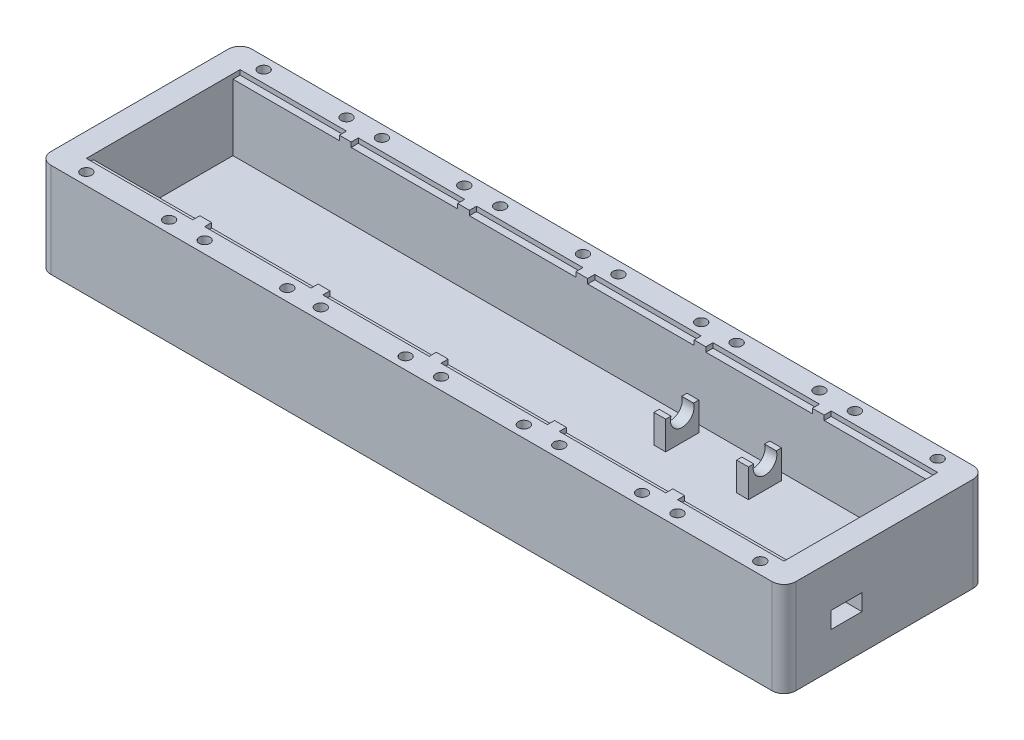
from build123d import *

# Parameters (mm, degrees)
SKIZZE2_W                       = 315
SKIZZE2_H                       = 40
AUFSATZ_LINEAR_AUSTRAGEN1_DEPTH = 85
SKIZZE4_W                       = 295
SKIZZE4_H                       = 59
SCHNITT_LINEAR_AUSTRAGEN1_DEPTH = 30
SKIZZE11_W                      = 45
SKIZZE11_H                      = 3
SKIZZE11_H_2                    = 3.008661904
SCHNITT_LINEAR_AUSTRAGEN4_DEPTH = 2
SKIZZE17_R                      = 2.3
SCHNITT_LINEAR_AUSTRAGEN6_DEPTH = 4
VERRUNDUNG2_R                   = 5
VERRUNDUNG3_R                   = 5
VERRUNDUNG4_R                   = 5
VERRUNDUNG6_R                   = 5
SKIZZE18_W                      = 13
SKIZZE18_H                      = 7
SCHNITT_LINEAR_AUSTRAGEN7_DEPTH = 10
SKIZZE20_W                      = 5
SKIZZE20_H                      = 14
AUFSATZ_LINEAR_AUSTRAGEN2_DEPTH = 12
SKIZZE21_R                      = 5
SCHNITT_LINEAR_AUSTRAGEN8_DEPTH = 71


with BuildPart() as part:
    # Skizze2 → Aufsatz-Linear austragen1 (new body)
    with BuildSketch(Plane.XY):
        with Locations((157.5, 20)):
            Rectangle(SKIZZE2_W, SKIZZE2_H)
    extrude(amount=AUFSATZ_LINEAR_AUSTRAGEN1_DEPTH)

    # Skizze4 → Schnitt-Linear austragen1 (cut)
    with BuildSketch(Plane(origin=(0, 40, 0), x_dir=(1, 0, 0), z_dir=(0, 1, 0))):
        with Locations((157.5, -42.5)):
            Rectangle(SKIZZE4_W, SKIZZE4_H)
    extrude(amount=-SCHNITT_LINEAR_AUSTRAGEN1_DEPTH, mode=Mode.SUBTRACT)

    # Skizze11 → Schnitt-Linear austragen4 (cut)
    with BuildSketch(Plane(origin=(0, 40, 0), x_dir=(1, 0, 0), z_dir=(0, 1, 0))):
        with Locations((32.5, -11.5)):
            Rectangle(SKIZZE11_W, SKIZZE11_H)
        with Locations((32.5, -73.5)):
            Rectangle(SKIZZE11_W, SKIZZE11_H)
        with Locations((82.5, -73.5)):
            Rectangle(SKIZZE11_W, SKIZZE11_H)
        with Locations((132.5, -73.504330952)):
            Rectangle(SKIZZE11_W, SKIZZE11_H_2)
        with Locations((182.5, -73.504330952)):
            Rectangle(SKIZZE11_W, SKIZZE11_H_2)
        with Locations((232.5, -73.5)):
            Rectangle(SKIZZE11_W, SKIZZE11_H)
        with Locations((282.5, -73.5)):
            Rectangle(SKIZZE11_W, SKIZZE11_H)
        with Locations((282.5, -11.5)):
            Rectangle(SKIZZE11_W, SKIZZE11_H)
        with Locations((232.5, -11.5)):
            Rectangle(SKIZZE11_W, SKIZZE11_H)
        with Locations((182.5, -11.5)):
            Rectangle(SKIZZE11_W, SKIZZE11_H)
        with Locations((132.5, -11.5)):
            Rectangle(SKIZZE11_W, SKIZZE11_H)
        with Locations((82.5, -11.5)):
            Rectangle(SKIZZE11_W, SKIZZE11_H)
    extrude(amount=-SCHNITT_LINEAR_AUSTRAGEN4_DEPTH, mode=Mode.SUBTRACT)

    # Skizze17 → Schnitt-Linear austragen6 (cut)
    with BuildSketch(Plane(origin=(0, 40, 0), x_dir=(1, 0, 0), z_dir=(0, 1, 0))):
        with Locations((50, -80)):
            Circle(SKIZZE17_R)
        with Locations((15, -80)):
            Circle(SKIZZE17_R)
        with Locations((15, -5)):
            Circle(SKIZZE17_R)
        with Locations((50, -5)):
            Circle(SKIZZE17_R)
        with Locations((65, -5)):
            Circle(SKIZZE17_R)
        with Locations((99.834927097, -5)):
            Circle(SKIZZE17_R)
        with Locations((65, -80)):
            Circle(SKIZZE17_R)
        with Locations((100, -80)):
            Circle(SKIZZE17_R)
        with Locations((114.145512134, -80)):
            Circle(SKIZZE17_R)
        with Locations((150, -80)):
            Circle(SKIZZE17_R)
        with Locations((165, -80)):
            Circle(SKIZZE17_R)
        with Locations((200, -80)):
            Circle(SKIZZE17_R)
        with Locations((215, -80)):
            Circle(SKIZZE17_R)
        with Locations((250, -80)):
            Circle(SKIZZE17_R)
        with Locations((265, -80)):
            Circle(SKIZZE17_R)
        with Locations((300, -80)):
            Circle(SKIZZE17_R)
        with Locations((300, -5)):
            Circle(SKIZZE17_R)
        with Locations((265, -5)):
            Circle(SKIZZE17_R)
        with Locations((250, -5)):
            Circle(SKIZZE17_R)
        with Locations((215, -5)):
            Circle(SKIZZE17_R)
        with Locations((200, -5)):
            Circle(SKIZZE17_R)
        with Locations((165, -5)):
            Circle(SKIZZE17_R)
        with Locations((150, -5)):
            Circle(SKIZZE17_R)
        with Locations((115, -5)):
            Circle(SKIZZE17_R)
    extrude(amount=-SCHNITT_LINEAR_AUSTRAGEN6_DEPTH, mode=Mode.SUBTRACT)

    # Verrundung2
    verrundung2_edges = [part.edges().sort_by_distance(p)[0] for p in [
        (0, 20, 85),
    ]]
    fillet(verrundung2_edges, radius=VERRUNDUNG2_R)

    # Verrundung3
    verrundung3_edges = [part.edges().sort_by_distance(p)[0] for p in [
        (0, 20, 0),
    ]]
    fillet(verrundung3_edges, radius=VERRUNDUNG3_R)

    # Verrundung4
    verrundung4_edges = [part.edges().sort_by_distance(p)[0] for p in [
        (315, 20, 0),
    ]]
    fillet(verrundung4_edges, radius=VERRUNDUNG4_R)

    # Verrundung6
    verrundung6_edges = [part.edges().sort_by_distance(p)[0] for p in [
        (315, 20, 85),
    ]]
    fillet(verrundung6_edges, radius=VERRUNDUNG6_R)

    # Skizze18 → Schnitt-Linear austragen7 (cut)
    with BuildSketch(Plane.ZY.offset(-305)):
        with Locations((58.5, 18.5)):
            Rectangle(SKIZZE18_W, SKIZZE18_H)
    extrude(amount=-SCHNITT_LINEAR_AUSTRAGEN7_DEPTH, mode=Mode.SUBTRACT)

    # Skizze20 → Aufsatz-Linear austragen2 (add)
    with BuildSketch(Plane(origin=(0, 10, 0), x_dir=(1, 0, 0), z_dir=(0, 1, 0))):
        with Locations((242.5, -23)):
            Rectangle(SKIZZE20_W, SKIZZE20_H)
        with Locations((207.5, -23)):
            Rectangle(SKIZZE20_W, SKIZZE20_H)
    extrude(amount=AUFSATZ_LINEAR_AUSTRAGEN2_DEPTH)

    # Skizze21 → Schnitt-Linear austragen8 (cut)
    with BuildSketch(Plane.ZY.offset(-205)):
        with Locations((23, 20.5)):
            Circle(SKIZZE21_R)
    extrude(amount=-SCHNITT_LINEAR_AUSTRAGEN8_DEPTH, mode=Mode.SUBTRACT)


solid = part.part
